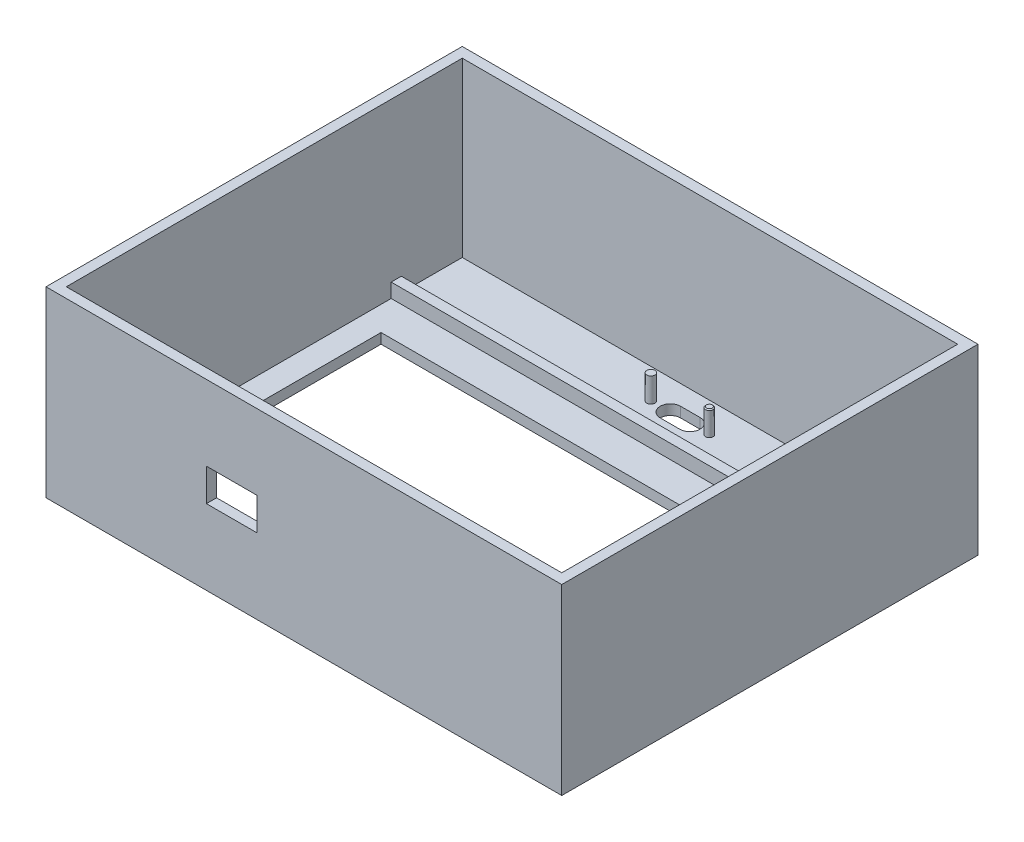
from build123d import *

# Parameters (mm, degrees)
SKETCH1_W           = 127
SKETCH1_H           = 85
BOSS_EXTRUDE1_DEPTH = 2.5
SKETCH2_W           = 127
SKETCH2_H           = 85
SKETCH2_W_2         = 122
SKETCH2_H_2         = 80
BOSS_EXTRUDE2_DEPTH = 38.5
SKETCH3_W           = 110
SKETCH3_H           = 68.5
CUT_EXTRUDE1_DEPTH  = 2.5
BOSS_EXTRUDE3_DEPTH = 15
SKETCH10_W          = 122
SKETCH10_H          = 2.5
CUT_EXTRUDE2_DEPTH  = 35
SKETCH11_W          = 127
SKETCH11_H          = 41
BOSS_EXTRUDE4_DEPTH = 2.5
CUT_EXTRUDE4_DEPTH  = 2.5
SKETCH14_W          = 15
SKETCH14_H          = 1
CUT_EXTRUDE5_DEPTH  = 1.5
SKETCH13_R          = 1
BOSS_EXTRUDE6_DEPTH = 6
SKETCH17_W          = 12.5
SKETCH17_H          = 8
CUT_EXTRUDE6_DEPTH  = 2.5
SKETCH19_W          = 127
SKETCH19_H          = 102.5
SKETCH19_W_2        = 122
SKETCH19_H_2        = 97.5
BOSS_EXTRUDE7_DEPTH = 4


# Read off the part's stored shape, not the designer's step: #1-64 Machine Threads Stud1
with BuildPart() as part:
    # Sketch1 → Boss-Extrude1 (new body)
    with BuildSketch(Plane(origin=(0, 0, 0), x_dir=(1, 0, 0), z_dir=(0, 1, 0))):
        with Locations((63.5, 42.5)):
            Rectangle(SKETCH1_W, SKETCH1_H)
    extrude(amount=BOSS_EXTRUDE1_DEPTH)

    # Sketch2 → Boss-Extrude2 (add)
    with BuildSketch(Plane(origin=(0, 2.5, 0), x_dir=(1, 0, 0), z_dir=(0, 1, 0))):
        with Locations((63.5, 42.5)):
            Rectangle(SKETCH2_W, SKETCH2_H)
        with Locations((63.5, 42.5)):
            Rectangle(SKETCH2_W_2, SKETCH2_H_2, mode=Mode.SUBTRACT)
    extrude(amount=BOSS_EXTRUDE2_DEPTH)

    # Sketch3 → Cut-Extrude1 (cut)
    with BuildSketch(Plane(origin=(0, 0, 0), x_dir=(-1, 0, 0), z_dir=(0, -1, 0))):
        with Locations((-63.5, 39.75)):
            Rectangle(SKETCH3_W, SKETCH3_H)
    extrude(amount=-CUT_EXTRUDE1_DEPTH, mode=Mode.SUBTRACT)

    # Sketch9 → Boss-Extrude3 (add)
    with BuildSketch(Plane(origin=(0, 0, -85), x_dir=(-1, 0, 0), z_dir=(0, 0, -1))):
        Polygon((-127, 0), (0, 0), (0, 2.5), (0, 41), (-2.5, 41), (-2.5, 2.5), (-124.5, 2.5), (-124.5, 41), (-127, 41), (-127, 2.5), align=None)
    extrude(amount=BOSS_EXTRUDE3_DEPTH)

    # Sketch10 → Cut-Extrude2 (cut)
    with BuildSketch(Plane(origin=(0, 41, 0), x_dir=(1, 0, 0), z_dir=(0, 1, 0))):
        with Locations((63.5, 83.75)):
            Rectangle(SKETCH10_W, SKETCH10_H)
    extrude(amount=-CUT_EXTRUDE2_DEPTH, mode=Mode.SUBTRACT)

    # Sketch11 → Boss-Extrude4 (add)
    with BuildSketch(Plane(origin=(0, 0, -100), x_dir=(-1, 0, 0), z_dir=(0, 0, -1))):
        with Locations((-63.5, 20.5)):
            Rectangle(SKETCH11_W, SKETCH11_H)
    extrude(amount=BOSS_EXTRUDE4_DEPTH)

    # Sketch6 → Cut-Extrude4 (cut)
    with BuildSketch(Plane(origin=(0, 0, 0), x_dir=(-1, 0, 0), z_dir=(0, -1, 0))):
        with BuildLine():
            Line((-61.1, 90.153713072), (-65.9, 90.153713072))
            ThreePointArc((-65.9, 90.153713072), (-68.4, 92.653713072), (-65.9, 95.153713072))
            Line((-65.9, 95.153713072), (-61.1, 95.153713072))
            ThreePointArc((-61.1, 95.153713072), (-58.6, 92.653713072), (-61.1, 90.153713072))
        make_face()
    extrude(amount=-CUT_EXTRUDE4_DEPTH, mode=Mode.SUBTRACT)

    # Sketch14 → Cut-Extrude5 (cut)
    with BuildSketch(Plane(origin=(0, 2.5, 0), x_dir=(1, 0, 0), z_dir=(0, 1, 0))):
        with Locations((63.5, 86.653713072)):
            Rectangle(SKETCH14_W, SKETCH14_H)
    extrude(amount=-CUT_EXTRUDE5_DEPTH, mode=Mode.SUBTRACT)

    # Sketch13 → Boss-Extrude6 (add)
    with BuildSketch(Plane(origin=(0, 2.5, 0), x_dir=(1, 0, 0), z_dir=(0, 1, 0))):
        with Locations((56.3, 92.653713072)):
            Circle(SKETCH13_R)
        with Locations((70.7, 92.653713072)):
            Circle(SKETCH13_R)
    extrude(amount=BOSS_EXTRUDE6_DEPTH)

    # Sketch17 → Cut-Extrude6 (cut)
    with BuildSketch(Plane.XY):
        with Locations((45.75, 22.5)):
            Rectangle(SKETCH17_W, SKETCH17_H)
    extrude(amount=-CUT_EXTRUDE6_DEPTH, mode=Mode.SUBTRACT)

    # Sketch19 → Boss-Extrude7 (add)
    with BuildSketch(Plane(origin=(0, 41, 0), x_dir=(1, 0, 0), z_dir=(0, 1, 0))):
        with Locations((63.5, 51.25)):
            Rectangle(SKETCH19_W, SKETCH19_H)
        with Locations((63.5, 51.25)):
            Rectangle(SKETCH19_W_2, SKETCH19_H_2, mode=Mode.SUBTRACT)
    extrude(amount=BOSS_EXTRUDE7_DEPTH)

    # #1-64 Machine Threads Stud1 outline → #1-64 Machine Threads Stud1 (revolve, cut)
    with BuildSketch(Plane(origin=(70.7, 0, -92.653713072), x_dir=(1, 0, 0), z_dir=(0, 0, 1))):
        Polygon((1, 8.5), (0.69088, 8.5), (0.9271, 8.26378), (0.9271, 2.5), (1, 2.5), align=None)
    revolve(axis=Axis((70.7, 0, -92.653713072), (0, 1, 0)), mode=Mode.SUBTRACT)


solid = part.part
